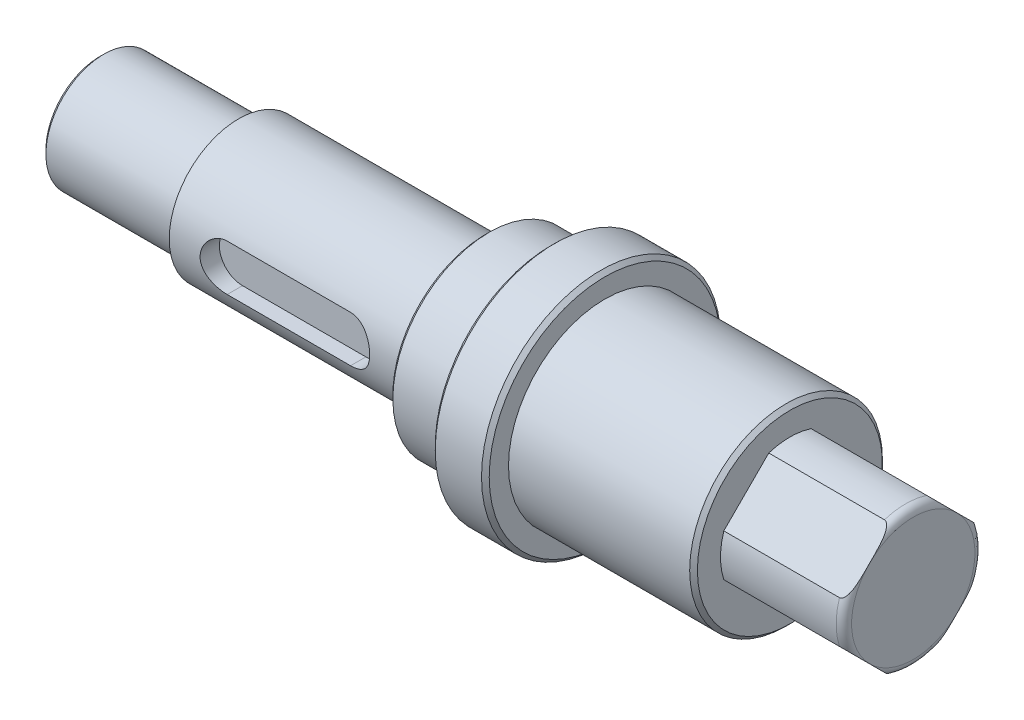
from build123d import *

# Parameters (mm, degrees)
CUT_EXTRUDE_1_DEPTH = 16
CUT_EXTRUDE_2_DEPTH = 2.5
FILLET_1_R          = 1
CHAMFER_1_SIZE      = 0.5


with BuildPart() as part:
    # 草图2 → 旋转1 (revolve)
    with BuildSketch(Plane.XY, mode=Mode.PRIVATE) as revolve_1_sk:
        Polygon((-89.5, 0), (-89.5, 7.5), (-71.5, 7.5), (-71.5, 9), (-39.5, 9), (-39.5, 12.5), (-31, 12.5), (-31, 15.5), (-24, 15.5), (-24, 12.5), (0, 12.5), (0, 9), (16, 9), (16, 0), align=None)
    revolve(revolve_1_sk.sketch.rotate(Axis((-90.878838174, 0, 0), (1, 0, 0)), 90), axis=Axis((-90.878838174, 0, 0), (1, 0, 0)))

    # 草图3 → 切除-拉伸1 (cut)
    with BuildSketch(Plane(origin=(16, 0, 0), x_dir=(0, 0, -1), z_dir=(1, 0, 0))):
        with BuildLine():
            ThreePointArc((-2.741378302, 8.572330197), (-6.363961031, 6.363961031), (-8.572330197, 2.741378302))
            Line((-8.572330197, 2.741378302), (-2.741378302, 8.572330197))
        make_face()
        with BuildLine():
            Line((-2.741378302, -8.572330197), (-8.572330197, -2.741378302))
            ThreePointArc((-8.572330197, -2.741378302), (-6.363961031, -6.363961031), (-2.741378302, -8.572330197))
        make_face()
        with BuildLine():
            Line((8.572330197, -2.741378302), (2.741378302, -8.572330197))
            ThreePointArc((2.741378302, -8.572330197), (6.363961031, -6.363961031), (8.572330197, -2.741378302))
        make_face()
        with BuildLine():
            ThreePointArc((8.572330197, 2.741378302), (6.363961031, 6.363961031), (2.741378302, 8.572330197))
            Line((2.741378302, 8.572330197), (8.572330197, 2.741378302))
        make_face()
    extrude(amount=-CUT_EXTRUDE_1_DEPTH, mode=Mode.SUBTRACT)

    # 草图5 → 切除-拉伸2 (cut)
    with BuildSketch(Plane.XY.offset(9)):
        with BuildLine():
            Line((-64.5, 3), (-48.5, 3))
            ThreePointArc((-48.5, 3), (-45.5, 0), (-48.5, -3))
            Line((-48.5, -3), (-64.5, -3))
            ThreePointArc((-64.5, -3), (-67.5, 0), (-64.5, 3))
        make_face()
    extrude(amount=-CUT_EXTRUDE_2_DEPTH, mode=Mode.SUBTRACT)

    # 圆角1
    fillet_1_edges = [part.edges().sort_by_distance(p)[0] for p in [
        (16, -9, 0),
        (16, 0, -9),
        (16, 9, 0),
        (16, 0, 9),
    ]]
    fillet(fillet_1_edges, radius=FILLET_1_R - 0.0001)  # a hair under: the kernel refuses the full size

    # 倒角1
    chamfer_1_edges = [part.edges().sort_by_distance(p)[0] for p in [
        (0, 0, -12.5),
        (-24, 0, -15.5),
        (-31, 0, -15.5),
        (-39.5, 0, -12.5),
        (-71.5, 0, -7.5),
        (-89.5, 0, -7.5),
    ]]
    chamfer(chamfer_1_edges, length=CHAMFER_1_SIZE)


solid = part.part
